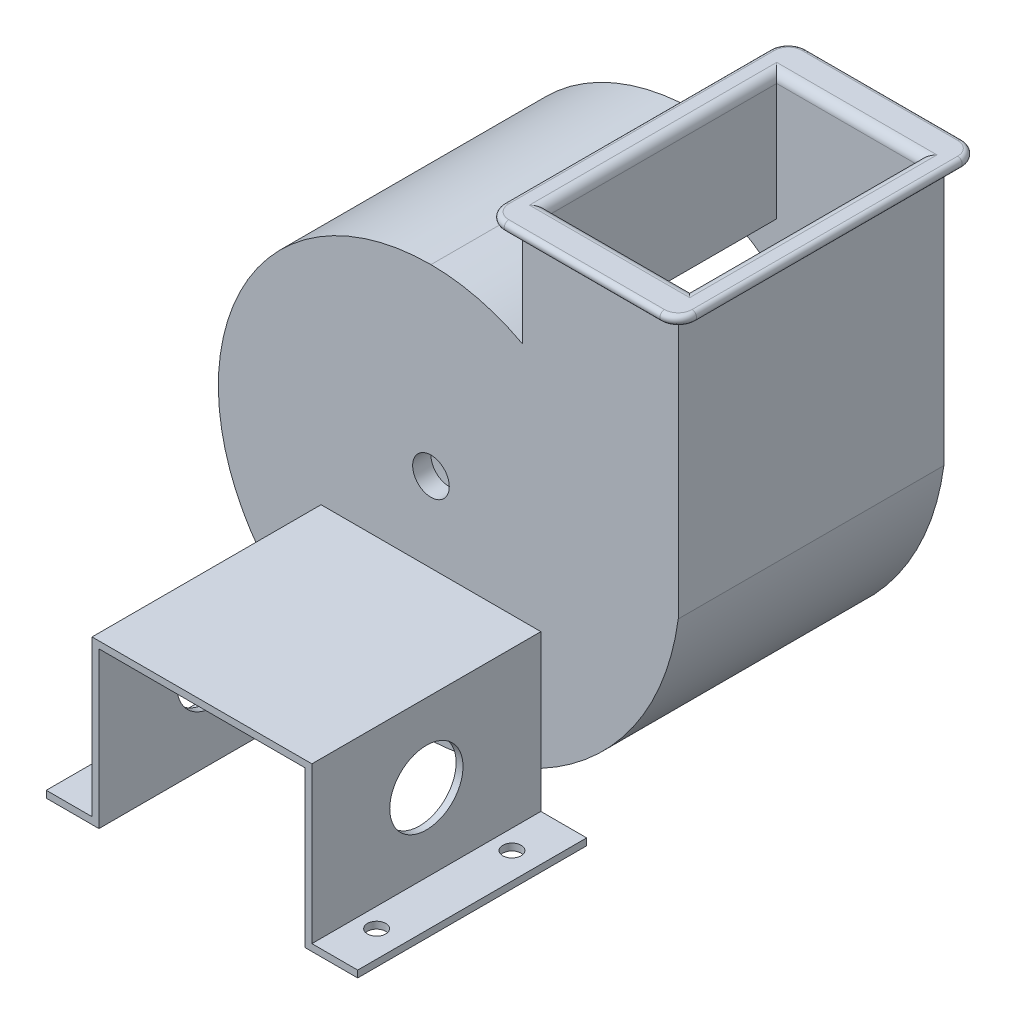
from build123d import *

# Parameters (mm, degrees)
SKETCH3_R           = 15
BOSS_EXTRUDE1_DEPTH = 2
BOSS_EXTRUDE2_DEPTH = 25
BOSS_EXTRUDE4_DEPTH = 2
SKETCH7_R           = 2
CUT_EXTRUDE1_DEPTH  = 2
BOSS_EXTRUDE5_DEPTH = 25
SKETCH9_R           = 4
CUT_EXTRUDE2_DEPTH  = 73.649845148
SKETCH10_R          = 1
CUT_EXTRUDE3_DEPTH  = 25
SKETCH18_R          = 0.5
CUT_EXTRUDE4_DEPTH  = 25
CIRPATTERN1_COUNT   = 12
SKETCH11_W          = 21
SKETCH11_H          = 33
SKETCH11_W_2        = 15.5
SKETCH11_H_2        = 25
BOSS_EXTRUDE7_DEPTH = 1
FILLET1_R           = 2
FILLET2_R           = 0.5
FILLET3_R           = 1


with BuildPart() as part:
    # Sketch3 → Boss-Extrude1 (new body)
    with BuildSketch(Plane.XY):
        with BuildLine():
            Line((27, 0), (27, 29))
            Line((27, 29), (10, 29))
            Line((10, 29), (10, 17.5))
            ThreePointArc((10, 17.5), (5.153882032, 19.365528128), (0, 20))
            ThreePointArc((0, 20), (-15.239750654, 14.300713252), (-23, 0))
            ThreePointArc((-23, 0), (-17.408173386, -17.935519516), (0, -25))
            ThreePointArc((0, -25), (17.998732227, -17.358630805), (27, 0))
        make_face()
        Circle(SKETCH3_R, mode=Mode.SUBTRACT)
    extrude(amount=BOSS_EXTRUDE1_DEPTH)

    # Sketch4 → Boss-Extrude2 (add)
    with BuildSketch(Plane.XY.offset(2)):
        with BuildLine():
            Line((10.75, 29), (10.75, 16.205300055))
            ThreePointArc((10.75, 16.205300055), (5.586427699, 18.474143215), (0, 19.25))
            ThreePointArc((0, 19.25), (-14.747616618, 13.734759111), (-22.257265877, -0.104144241))
            ThreePointArc((-22.257265877, -0.104144241), (-16.856225128, -17.427727117), (-0.041996015, -24.2511767))
            ThreePointArc((-0.041996015, -24.2511767), (17.470976117, -16.825147336), (26.25, 0.050244354))
            Line((26.25, 0.050244354), (26.25, 29))
            Line((26.25, 29), (27, 29))
            Line((27, 29), (27, 0))
            ThreePointArc((27, 0), (17.998732227, -17.358630805), (0, -25))
            ThreePointArc((0, -25), (-17.408173386, -17.935519516), (-23, 0))
            ThreePointArc((-23, 0), (-15.239750654, 14.300713252), (0, 20))
            ThreePointArc((0, 20), (5.153882032, 19.365528128), (10, 17.5))
            Line((10, 17.5), (10, 29))
            Line((10, 29), (10.75, 29))
        make_face()
    extrude(amount=BOSS_EXTRUDE2_DEPTH)

    # Sketch6 → Boss-Extrude4 (add)
    with BuildSketch(Plane.XY.offset(27)):
        with BuildLine():
            Line((10, 29), (27, 29))
            Line((27, 29), (27, 0))
            ThreePointArc((27, 0), (17.998732227, -17.358630805), (0, -25))
            ThreePointArc((0, -25), (-17.408173386, -17.935519516), (-23, 0))
            ThreePointArc((-23, 0), (-15.239750654, 14.300713252), (0, 20))
            ThreePointArc((0, 20), (5.153882032, 19.365528128), (10, 17.5))
            Line((10, 17.5), (10, 29))
        make_face()
    extrude(amount=BOSS_EXTRUDE4_DEPTH)

    # Sketch7 → Cut-Extrude1 (cut)
    with BuildSketch(Plane.XY.offset(29)):
        Circle(SKETCH7_R)
    extrude(amount=-CUT_EXTRUDE1_DEPTH, mode=Mode.SUBTRACT)

    # Sketch8 → Boss-Extrude5 (add)
    with BuildSketch(Plane.XY.offset(29)):
        Polygon((-12, -8.702983609), (12, -8.702983609), (12, -25.702983609), (17, -25.702983609), (17, -26.452983609), (11.25, -26.452983609), (11.25, -9.452983609), (-11.25, -9.452983609), (-11.25, -26.452983609), (-17, -26.452983609), (-17, -25.702983609), (-12, -25.702983609), align=None)
    extrude(amount=BOSS_EXTRUDE5_DEPTH)

    # Sketch9 → Cut-Extrude2 (cut, through all)
    with BuildSketch(Plane.ZY.offset(12)):
        with Locations((41.5, -17.202983609)):
            Circle(SKETCH9_R)
    extrude(amount=-CUT_EXTRUDE2_DEPTH, mode=Mode.SUBTRACT)

    # Sketch10 → Cut-Extrude3 (cut)
    with BuildSketch(Plane(origin=(0, -25.702983609, 0), x_dir=(1, 0, 0), z_dir=(0, 1, 0))):
        with Locations(Location((-14.511775324, -34.274046309, 0), (0, 0, 270))):
            Circle(SKETCH10_R)
        with Locations(Location((-14.511775324, -49.054289342, 0), (0, 0, 270))):
            Circle(SKETCH10_R)
        with Locations(Location((14.120109084, -49.054289342, 0), (0, 0, 270))):
            Circle(SKETCH10_R)
        with Locations(Location((14.120109084, -34.274046309, 0), (0, 0, 270))):
            Circle(SKETCH10_R)
    extrude(amount=-CUT_EXTRUDE3_DEPTH, mode=Mode.SUBTRACT)

    # Sketch18 → Cut-Extrude4 (cut)
    with BuildSketch(Plane(origin=(0, 0, 0), x_dir=(-1, 0, 0), z_dir=(0, 0, -1))):
        with Locations((1.248141766, 17.455433026)):
            Circle(SKETCH18_R)
    cut_extrude4 = extrude(amount=-CUT_EXTRUDE4_DEPTH, mode=Mode.SUBTRACT)

    # CirPattern1: Cut-Extrude4 ×12 about axis
    cirpattern1_axis = Axis((0, 0, 0), (0, 0, 1))
    for i in range(1, CIRPATTERN1_COUNT):
        add(cut_extrude4.rotate(cirpattern1_axis, i * 360 / CIRPATTERN1_COUNT), mode=Mode.SUBTRACT)


with BuildPart() as body_2:
    # Sketch11 → Boss-Extrude7 (new body)
    with BuildSketch(Plane(origin=(0, 29, 0), x_dir=(1, 0, 0), z_dir=(0, 1, 0))):
        with Locations((18.5, -14.5)):
            Rectangle(SKETCH11_W, SKETCH11_H)
        with Locations((18.5, -14.5)):
            Rectangle(SKETCH11_W_2, SKETCH11_H_2, mode=Mode.SUBTRACT)
    extrude(amount=BOSS_EXTRUDE7_DEPTH)

    # Fillet1
    fillet1_edges = [body_2.edges().sort_by_distance(p)[0] for p in [
        (29, 29.5, 31),
        (8, 29.5, 31),
        (8, 29.5, -2),
        (29, 29.5, -2),
    ]]
    fillet(fillet1_edges, radius=FILLET1_R)

    # Fillet2
    fillet2_edges = [body_2.edges().sort_by_distance(p)[0] for p in [
        (29, 29, 14.5),
        (29, 30, 14.5),
        (18.5, 29, 31),
        (8, 29, 14.5),
        (18.5, 29, -2),
        (8.585786438, 29, 30.414213562),
        (8.585786438, 29, -1.414213562),
        (28.414213562, 29, -1.414213562),
        (28.414213562, 29, 30.414213562),
        (18.5, 30, 31),
        (18.5, 30, -2),
        (8, 30, 14.5),
    ]]
    fillet(fillet2_edges, radius=FILLET2_R - 0.0001)  # a hair under: the kernel refuses the full size

    # Fillet3
    fillet3_edges = [body_2.edges().sort_by_distance(p)[0] for p in [
        (10.75, 30, 14.5),
        (18.5, 30, 2),
        (26.25, 30, 14.5),
        (18.5, 30, 27),
    ]]
    fillet(fillet3_edges, radius=FILLET3_R - 0.0001)  # a hair under: the kernel refuses the full size


solid = Compound([part.part, body_2.part])
